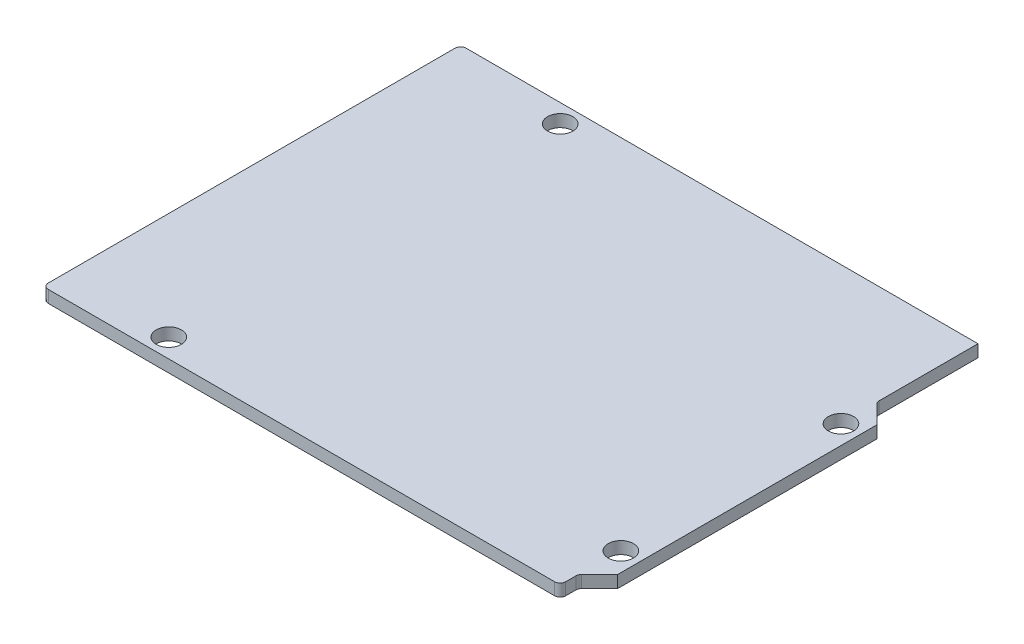
from build123d import *

# Parameters (mm, degrees)
ESQUISSE1_R        = 1.6
BOSS_EXTRU_1_DEPTH = 1.55
CONG_1_R           = 0.7


with BuildPart() as part:
    # Esquisse1 → Boss.-Extru.1 (new body)
    with BuildSketch(Plane(origin=(0, 0, 0), x_dir=(1, 0, 0), z_dir=(0, 1, 0))):
        Polygon((65.7, 53.05), (65.7, 40.2), (68.2, 37.7), (68.2, 4.8), (65.7, 2.3), (65.7, 0), (0, 0), (0, 53.05), align=None)
        with Locations((15, 50.7)):
            Circle(ESQUISSE1_R, mode=Mode.SUBTRACT)
        with Locations((13.6, 2.4)):
            Circle(ESQUISSE1_R, mode=Mode.SUBTRACT)
        with Locations((65.8, 7.6)):
            Circle(ESQUISSE1_R, mode=Mode.SUBTRACT)
        with Locations((65.8, 35.55)):
            Circle(ESQUISSE1_R, mode=Mode.SUBTRACT)
    extrude(amount=BOSS_EXTRU_1_DEPTH)

    # Congé1
    cong_1_edges = [part.edges().sort_by_distance(p)[0] for p in [
        (65.7, 0.775, -40.2),
        (65.7, 0.775, -2.3),
        (65.7, 0.775, 0),
        (0, 0.775, -53.05),
        (0, 0.775, 0),
    ]]
    fillet(cong_1_edges, radius=CONG_1_R)


solid = part.part
